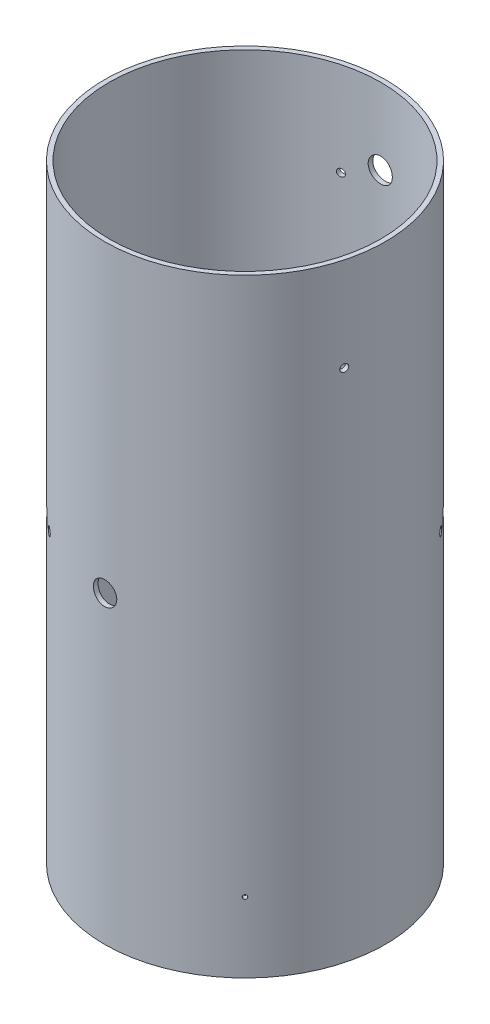
from build123d import *

# Parameters (mm, degrees)
SKETCH1_R               = 76.1746
SKETCH1_R_2             = 73.66
BOSS_EXTRUDE1_DEPTH     = 330.2
CUT_EXTRUDE1_DEPTH      = 348.328633238
CUT_EXTRUDE1_DEPTH_BACK = 348.328633238
SKETCH27_R              = 6.35
CUT_EXTRUDE2_DEPTH      = 348.328633238
CUT_EXTRUDE2_DEPTH_BACK = 348.328633238
SKETCH30_R              = 2.18313
SKETCH30_W              = 9.906
SKETCH30_H              = 9.906
SKETCH23_R              = 1.0922
SHEAR_SCRREWS_DEPTH     = 348.328633238
CIRPATTERN1_COUNT       = 4
CIRPATTERN2_COUNT       = 3


with BuildPart() as part:
    # Sketch1 → Boss-Extrude1 (new body)
    with BuildSketch(Plane(origin=(0, 0, 0), x_dir=(1, 0, 0), z_dir=(0, 1, 0))):
        Circle(SKETCH1_R)
        Circle(SKETCH1_R_2, mode=Mode.SUBTRACT)
    extrude(amount=BOSS_EXTRUDE1_DEPTH)

    # Sketch17 → 1/2 Clearance Hole5 (revolve, cut)
    with BuildSketch(Plane(origin=(0, 288.925, 0), x_dir=(0, -1, 0), z_dir=(1, 0, 0))):
        Polygon((0, 0), (0, 80.134507437), (6.54812, 76.2), (6.54812, 0), align=None)
    revolve(axis=Axis((0, 288.925, 6.35), (0, 0, -1)), mode=Mode.SUBTRACT)

    # Sketch27 → Cut-Extrude1 (cut, two sides: drawn at the far end of the back side and taken through both)
    with BuildSketch(Plane.XY.offset(-CUT_EXTRUDE1_DEPTH_BACK)):
        with Locations((0, 165.1)):
            Circle(SKETCH27_R)
    extrude(amount=CUT_EXTRUDE1_DEPTH + CUT_EXTRUDE1_DEPTH_BACK, mode=Mode.SUBTRACT)

    # Sketch30 → Cut-Extrude2 (cut, two sides: drawn at the far end of the back side and taken through both)
    with BuildSketch(Plane(origin=(0, 0, 0), x_dir=(0.7071067811865477, 0, 0.7071067811865475), z_dir=(-0.7071067811865475, 0, 0.7071067811865477)).offset(-CUT_EXTRUDE2_DEPTH_BACK)):
        with Locations((-12.7, 165.1)):
            Circle(SKETCH30_R)
        with Locations((12.7, 165.1)):
            Circle(SKETCH30_R)
        with Locations((0, 165.1)):
            Rectangle(SKETCH30_W, SKETCH30_H)
    extrude(amount=CUT_EXTRUDE2_DEPTH + CUT_EXTRUDE2_DEPTH_BACK, mode=Mode.SUBTRACT)

    # Sketch23 → Shear Scrrews (cut, through all)
    with BuildSketch(Plane(origin=(0, 0, 0), x_dir=(0.7071067811865477, 0, 0.7071067811865475), z_dir=(-0.7071067811865475, 0, 0.7071067811865477))):
        with Locations((0, 38.1)):
            Circle(SKETCH23_R)
    shear_scrrews = extrude(amount=-SHEAR_SCRREWS_DEPTH, mode=Mode.SUBTRACT)

    # CirPattern1: Shear Scrrews ×4 about axis
    cirpattern1_axis = Axis((0, 330.2, 0), (0, -1, 0))
    for i in range(1, CIRPATTERN1_COUNT):
        add(shear_scrrews.rotate(cirpattern1_axis, i * 360 / CIRPATTERN1_COUNT), mode=Mode.SUBTRACT)

    # Sketch25 → Ø4.0 (4) Diameter Hole1 (revolve, cut)
    with BuildSketch(Plane(origin=(0, 279.4, 0), x_dir=(-0.7071067811865464, 0, -0.7071067811865488), z_dir=(0, 1, 0))):
        Polygon((0, 0), (0, 90.101721238), (2, 88.9), (2, 0), align=None)
    f_4_0_4_diameter_hole1 = revolve(axis=Axis((4.490128061, 279.4, -4.490128061), (-0.7071067811865487, 0, 0.7071067811865464)), mode=Mode.SUBTRACT)

    # CirPattern2: Ø4.0 (4) Diameter Hole1 ×3 about axis
    cirpattern2_axis = Axis((0, 330.2, 0), (0, 1, 0))
    for i in range(1, CIRPATTERN2_COUNT):
        add(f_4_0_4_diameter_hole1.rotate(cirpattern2_axis, i * 360 / CIRPATTERN2_COUNT), mode=Mode.SUBTRACT)


solid = part.part
